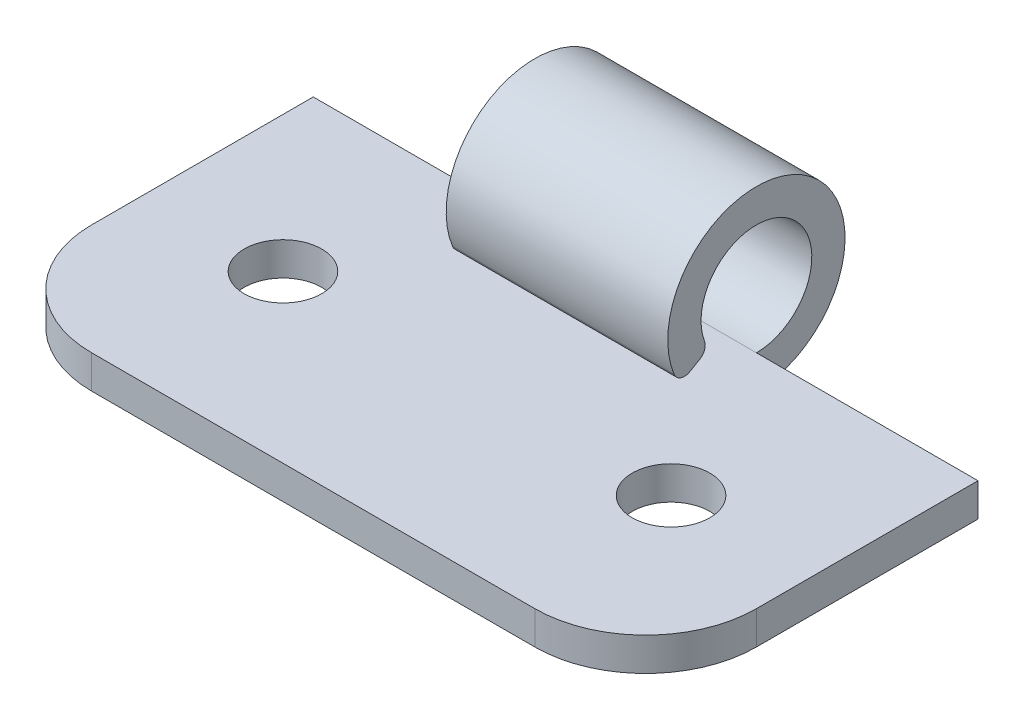
from build123d import *

# Parameters (mm, degrees)
SKETCH_1_W      = 30
SKETCH_1_H      = 15
SKETCH_1_R      = 1.75
EXTRUDE_1_DEPTH = 1.5
FILLET_1_R      = 5
EXTRUDE_3_DEPTH = 5


with BuildPart() as part:
    # 草图1 → 凸台-拉伸1 (new body)
    with BuildSketch(Plane(origin=(0, 0, 0), x_dir=(1, 0, 0), z_dir=(0, 1, 0))):
        Rectangle(SKETCH_1_W, SKETCH_1_H)
        with Locations((-8.867330988, 0)):
            Circle(SKETCH_1_R, mode=Mode.SUBTRACT)
        with Locations((8.647397187, 0)):
            Circle(SKETCH_1_R, mode=Mode.SUBTRACT)
    extrude(amount=EXTRUDE_1_DEPTH)

    # 圆角1
    fillet_1_edges = [part.edges().sort_by_distance(p)[0] for p in [
        (15, 0.75, 7.5),
        (-15, 0.75, 7.5),
    ]]
    fillet(fillet_1_edges, radius=FILLET_1_R)

    # 草图2 → 凸台-拉伸3 (add, symmetric)
    with BuildSketch(Plane(origin=(0, 0, 0), x_dir=(0, 0, -1), z_dir=(1, 0, 0))):
        with BuildLine():
            Line((4.938262309, 2.520980054), (4.5, 2.267949192))
            ThreePointArc((4.5, 2.267949192), (4.086336582, 2.228506303), (3.785714286, 2.515385022))
            ThreePointArc((3.785714286, 2.515385022), (9.742937815, 7.311982783), (7.5, 0))
            Line((7.5, 0), (7.5, 1.5))
            ThreePointArc((7.5, 1.5), (8.926677651, 6.052946877), (5.156885257, 3.128327297))
            ThreePointArc((5.156885257, 3.128327297), (5.15871146, 2.784648148), (4.938262309, 2.520980054))
        make_face()
    extrude(amount=EXTRUDE_3_DEPTH, both=True)


solid = part.part
